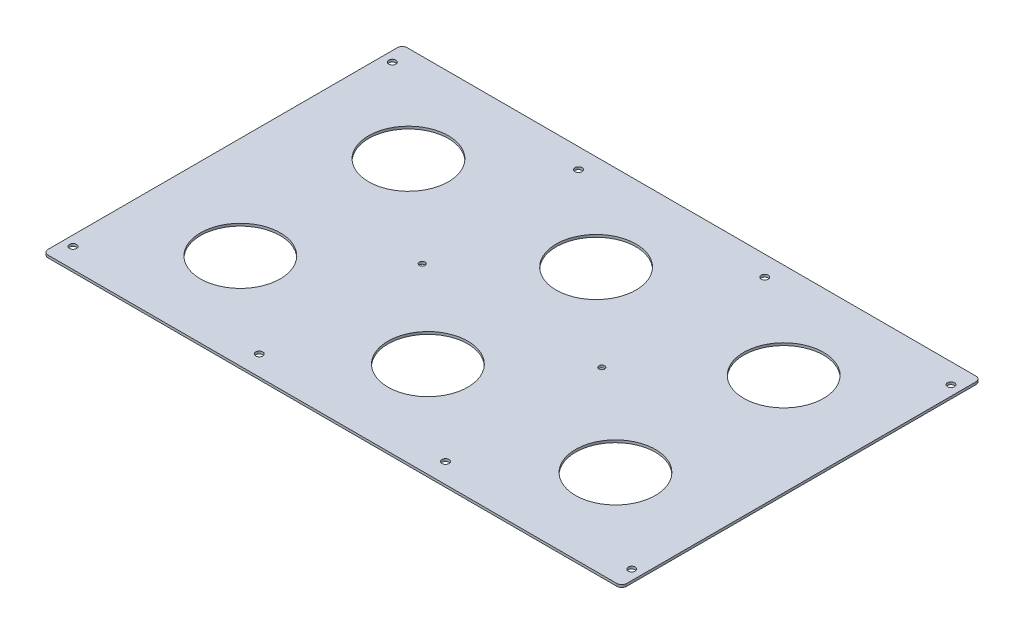
from build123d import *

# Parameters (mm, degrees)
SKETCH1_R           = 25.4
SKETCH1_R_2         = 2.2479
SKETCH1_R_3         = 1.8288
BOSS_EXTRUDE1_DEPTH = 1.5748


with BuildPart() as part:
    # Sketch1 → Boss-Extrude1 (new body)
    with BuildSketch(Plane(origin=(0, 0, 0), x_dir=(1, 0, 0), z_dir=(0, 1, 0))):
        with BuildLine():
            Line((-180.975, -114.3), (180.975, -114.3))
            ThreePointArc((180.975, -114.3), (183.22006403, -113.37006403), (184.15, -111.125))
            Line((184.15, -111.125), (184.15, 111.125))
            ThreePointArc((184.15, 111.125), (183.22006403, 113.37006403), (180.975, 114.3))
            Line((180.975, 114.3), (-180.975, 114.3))
            ThreePointArc((-180.975, 114.3), (-183.22006403, 113.37006403), (-184.15, 111.125))
            Line((-184.15, 111.125), (-184.15, -111.125))
            ThreePointArc((-184.15, -111.125), (-183.22006403, -113.37006403), (-180.975, -114.3))
        make_face()
        with Locations((119.38, 53.5178)):
            Circle(SKETCH1_R, mode=Mode.SUBTRACT)
        with Locations((-119.38, -53.5178)):
            Circle(SKETCH1_R, mode=Mode.SUBTRACT)
        with Locations((119.38, -53.5178)):
            Circle(SKETCH1_R, mode=Mode.SUBTRACT)
        with Locations((0, -53.5178)):
            Circle(SKETCH1_R, mode=Mode.SUBTRACT)
        with Locations((0, 53.5178)):
            Circle(SKETCH1_R, mode=Mode.SUBTRACT)
        with Locations((-119.38, 53.5178)):
            Circle(SKETCH1_R, mode=Mode.SUBTRACT)
        with Locations((177.8, 101.6)):
            Circle(SKETCH1_R_2, mode=Mode.SUBTRACT)
        with Locations((177.8, -101.6)):
            Circle(SKETCH1_R_2, mode=Mode.SUBTRACT)
        with Locations((59.266666667, -101.6)):
            Circle(SKETCH1_R_2, mode=Mode.SUBTRACT)
        with Locations((-59.266666667, -101.6)):
            Circle(SKETCH1_R_2, mode=Mode.SUBTRACT)
        with Locations((-177.8, -101.6)):
            Circle(SKETCH1_R_2, mode=Mode.SUBTRACT)
        with Locations((-59.266666667, 101.6)):
            Circle(SKETCH1_R_2, mode=Mode.SUBTRACT)
        with Locations((-177.8, 101.6)):
            Circle(SKETCH1_R_2, mode=Mode.SUBTRACT)
        with Locations((59.266666667, 101.6)):
            Circle(SKETCH1_R_2, mode=Mode.SUBTRACT)
        with Locations((57.15, 0)):
            Circle(SKETCH1_R_3, mode=Mode.SUBTRACT)
        with Locations((-57.15, 0)):
            Circle(SKETCH1_R_3, mode=Mode.SUBTRACT)
    extrude(amount=BOSS_EXTRUDE1_DEPTH)


solid = part.part
